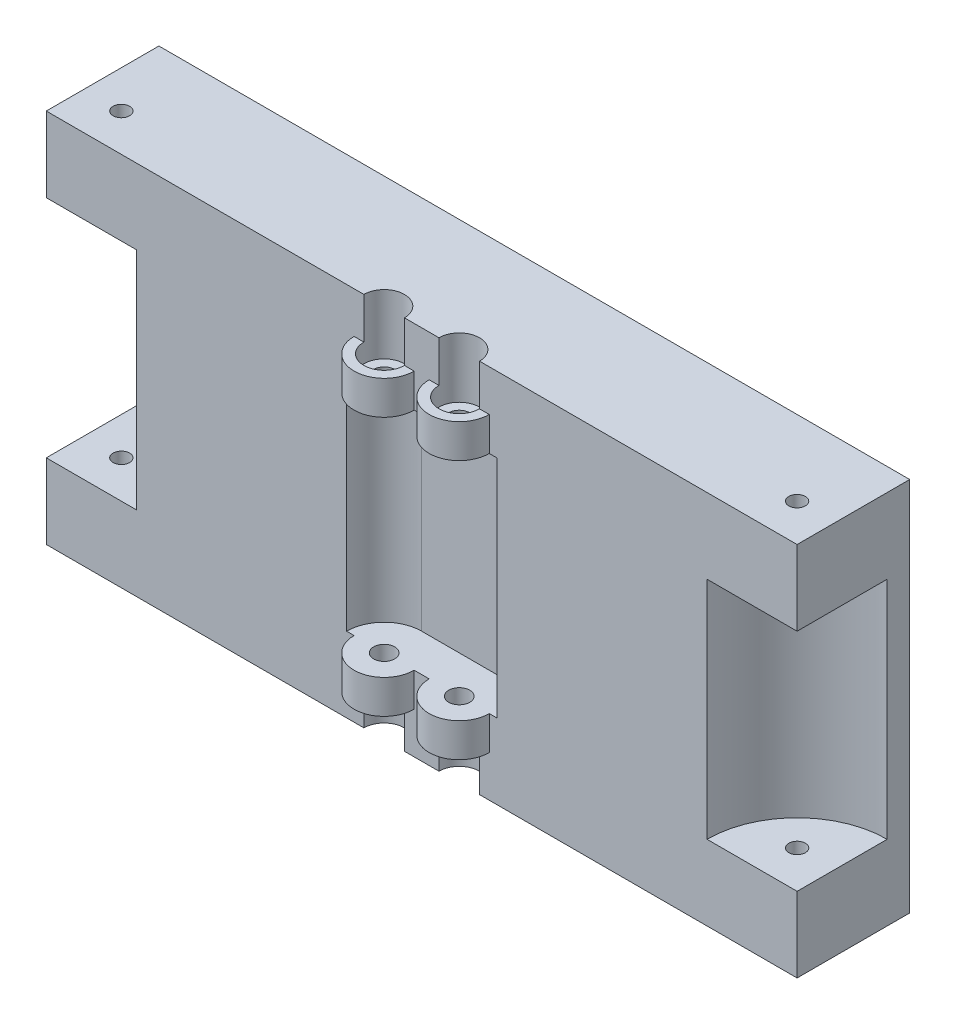
from build123d import *

# Parameters (mm, degrees)
SKETCH_1_W               = 100
SKETCH_1_H               = 15
EXTRUDE_1_DEPTH          = 50
SKETCH_2_R               = 1.1
CUT_EXTRUDE_1_DEPTH      = 72.107313267
SKETCH_3_W               = 12
SKETCH_3_H               = 30
CUT_EXTRUDE_5_DEPTH      = 15
CUT_EXTRUDE_5_DEPTH_BACK = 15
EXTRUDE_2_DEPTH          = 4.5
CUT_EXTRUDE_START        = -2.5
SKETCH_5_R               = 2.7
CUT_EXTRUDE_2_DEPTH      = 12.5
SKETCH_6_R               = 1.4
CUT_EXTRUDE_4_DEPTH      = 67.304223093
MIRROR_4_COPY_1_DEPTH    = 4.5
MIRROR_START             = -2.5
MIRROR_4_COPY_2_SKETCH_R = 2.7
MIRROR_4_COPY_2_DEPTH    = 12.5
MIRROR_4_COPY_3_SKETCH_R = 1.4
MIRROR_4_COPY_3_DEPTH    = 67.304223093
MIRROR_4_COPY_4_DEPTH    = 4.5
MIRROR_4_COPY_5_SKETCH_R = 2.7
MIRROR_4_COPY_5_DEPTH    = 12.5
MIRROR_4_COPY_6_SKETCH_R = 1.4
MIRROR_4_COPY_6_DEPTH    = 67.304223093


with BuildPart() as part:
    # 草图1 → 凸台-拉伸1 (new body)
    with BuildSketch(Plane(origin=(0, 0, 0), x_dir=(1, 0, 0), z_dir=(0, 1, 0))):
        Rectangle(SKETCH_1_W, SKETCH_1_H)
    extrude(amount=EXTRUDE_1_DEPTH)

    # 草图2 → 切除-拉伸1 (cut, through all)
    with BuildSketch(Plane(origin=(0, 50, 0), x_dir=(1, 0, 0), z_dir=(0, 1, 0))):
        with Locations((-45, -2.5)):
            Circle(SKETCH_2_R)
        with Locations((45, -2.5)):
            Circle(SKETCH_2_R)
    extrude(amount=-CUT_EXTRUDE_1_DEPTH, mode=Mode.SUBTRACT)

    # 草图3 → 切除-旋转1 (revolve, cut)
    with BuildSketch(Plane.XY.offset(7.5)):
        with Locations((-44, 25)):
            Rectangle(SKETCH_3_W, SKETCH_3_H)
    cut_revolve_1 = revolve(axis=Axis((-50, 10, 7.5), (0, 1, 0)), mode=Mode.SUBTRACT)

    # 镜向1: 切除-旋转1 across plane
    add(cut_revolve_1.mirror(Plane.ZY), mode=Mode.SUBTRACT)

    # 草图10 → 切除-拉伸5 (cut, two sides: drawn at the far end of the back side and taken through both)
    with BuildSketch(Plane.XZ.offset(-25).offset(-CUT_EXTRUDE_5_DEPTH_BACK)):
        with BuildLine():
            Line((-5, 2.5), (5, 2.5))
            ThreePointArc((5, 2.5), (8.535533906, 3.964466094), (10, 7.5))
            Line((10, 7.5), (-10, 7.5))
            ThreePointArc((-10, 7.5), (-8.535533906, 3.964466094), (-5, 2.5))
        make_face()
    extrude(amount=CUT_EXTRUDE_5_DEPTH + CUT_EXTRUDE_5_DEPTH_BACK, mode=Mode.SUBTRACT)

    # 草图7 → 凸台-拉伸2 (add)
    with BuildSketch(Plane(origin=(0, 40, 0), x_dir=(1, 0, 0), z_dir=(0, 1, 0))):
        with BuildLine():
            Line((-9, -7.5), (-1, -7.5))
            ThreePointArc((-1, -7.5), (-5, -11.5), (-9, -7.5))
        make_face()
    extrude_2 = extrude(amount=EXTRUDE_2_DEPTH)

    # 草图5 → 切除-拉伸2 (cut)
    with BuildSketch(Plane(origin=(0, 44.5, 0), x_dir=(1, 0, 0), z_dir=(0, 1, 0)).offset(CUT_EXTRUDE_START)):
        with Locations((-5, -7.5)):
            Circle(SKETCH_5_R)
    cut_extrude_2 = extrude(amount=CUT_EXTRUDE_2_DEPTH, mode=Mode.SUBTRACT)

    # 草图6 → 切除-拉伸4 (cut, through all)
    with BuildSketch(Plane(origin=(0, 42, 0), x_dir=(1, 0, 0), z_dir=(0, 1, 0))):
        with Locations((-5, -7.5)):
            Circle(SKETCH_6_R)
    cut_extrude_4 = extrude(amount=-CUT_EXTRUDE_4_DEPTH, mode=Mode.SUBTRACT)

    # 镜向2: 凸台-拉伸2, 切除-拉伸2, 切除-拉伸4 across plane
    add(extrude_2.mirror(Plane(origin=(0, 25, 0), x_dir=(0, 0, 1), z_dir=(0, -1, 0))))
    add(cut_extrude_2.mirror(Plane(origin=(0, 25, 0), x_dir=(0, 0, 1), z_dir=(0, -1, 0))), mode=Mode.SUBTRACT)
    add(cut_extrude_4.mirror(Plane(origin=(0, 25, 0), x_dir=(0, 0, 1), z_dir=(0, -1, 0))), mode=Mode.SUBTRACT)

    # 镜向4 copy 1 sketch → 镜向4 copy 1 (add)
    with BuildSketch(Plane(origin=(0, 10, 0), x_dir=(-1, 0, 0), z_dir=(0, -1, 0))):
        with BuildLine():
            Line((-9, -7.5), (-1, -7.5))
            ThreePointArc((-1, -7.5), (-5, -11.5), (-9, -7.5))
        make_face()
    extrude(amount=MIRROR_4_COPY_1_DEPTH)

    # 镜向4 copy 2 sketch → 镜向4 copy 2 (cut)
    with BuildSketch(Plane(origin=(0, 5.5, 0), x_dir=(-1, 0, 0), z_dir=(0, -1, 0)).offset(MIRROR_START)):
        with Locations((-5, -7.5)):
            Circle(MIRROR_4_COPY_2_SKETCH_R)
    extrude(amount=MIRROR_4_COPY_2_DEPTH, mode=Mode.SUBTRACT)

    # 镜向4 copy 3 sketch → 镜向4 copy 3 (cut, through all)
    with BuildSketch(Plane(origin=(0, 8, 0), x_dir=(-1, 0, 0), z_dir=(0, -1, 0))):
        with Locations((-5, -7.5)):
            Circle(MIRROR_4_COPY_3_SKETCH_R)
    extrude(amount=-MIRROR_4_COPY_3_DEPTH, mode=Mode.SUBTRACT)

    # 镜向4 copy 4 sketch → 镜向4 copy 4 (add)
    with BuildSketch(Plane(origin=(0, 40, 0), x_dir=(-1, 0, 0), z_dir=(0, 1, 0))):
        with BuildLine():
            Line((-9, 7.5), (-1, 7.5))
            ThreePointArc((-1, 7.5), (-5, 11.5), (-9, 7.5))
        make_face()
    extrude(amount=MIRROR_4_COPY_4_DEPTH)

    # 镜向4 copy 5 sketch → 镜向4 copy 5 (cut)
    with BuildSketch(Plane(origin=(0, 44.5, 0), x_dir=(-1, 0, 0), z_dir=(0, 1, 0)).offset(MIRROR_START)):
        with Locations((-5, 7.5)):
            Circle(MIRROR_4_COPY_5_SKETCH_R)
    extrude(amount=MIRROR_4_COPY_5_DEPTH, mode=Mode.SUBTRACT)

    # 镜向4 copy 6 sketch → 镜向4 copy 6 (cut, through all)
    with BuildSketch(Plane(origin=(0, 42, 0), x_dir=(-1, 0, 0), z_dir=(0, 1, 0))):
        with Locations((-5, 7.5)):
            Circle(MIRROR_4_COPY_6_SKETCH_R)
    extrude(amount=-MIRROR_4_COPY_6_DEPTH, mode=Mode.SUBTRACT)


solid = part.part
